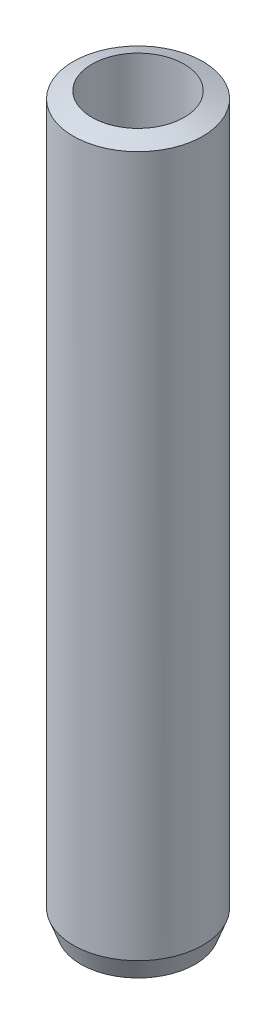
from build123d import *

# Parameters (mm, degrees)
SKETCH1_R           = 50
BOSS_EXTRUDE1_DEPTH = 562.517728
SKETCH2_R           = 35.621530439
CUT_EXTRUDE1_DEPTH  = 567.944613092
CHAMFER1_SIZE       = 5.901113
CHAMFER1_SIZE_2     = 15.741357


with BuildPart() as part:
    # Sketch1 → Boss-Extrude1 (new body)
    with BuildSketch(Plane(origin=(0, 0, 0), x_dir=(1, 0, 0), z_dir=(0, 1, 0))):
        with Locations(Location((0, 0, 0), (0, 0, 270))):
            Circle(SKETCH1_R)
    extrude(amount=BOSS_EXTRUDE1_DEPTH)

    # Sketch2 → Cut-Extrude1 (cut, through all)
    with BuildSketch(Plane(origin=(0, 0, 0), x_dir=(1, 0, 0), z_dir=(0, 1, 0))):
        with Locations(Location((0, 0, 0), (0, 0, 270))):
            Circle(SKETCH2_R)
    extrude(amount=CUT_EXTRUDE1_DEPTH, mode=Mode.SUBTRACT)

    # Chamfer1
    # the kernel refuses this chamfer: 15.741357, 5.901113 mm, written as the material it takes off along each edge
    with BuildSketch(Plane(origin=(0, 562.517728, 0), x_dir=(0, 0, 1), z_dir=(-1, 0, 0))) as chamfer1_piece_1:
        Polygon((50, -CHAMFER1_SIZE), (50 - CHAMFER1_SIZE_2, 0), (50, 0), align=None)
    revolve(axis=Axis((0, 562.517728, 0), (0, 1, 0)), mode=Mode.SUBTRACT)
    with BuildSketch(Plane(origin=(0, 0, 0), x_dir=(0, 0, 1), z_dir=(-1, 0, 0))) as chamfer1_piece_2:
        Polygon((50, CHAMFER1_SIZE_2), (50 - CHAMFER1_SIZE, 0), (50, 0), align=None)
    revolve(axis=Axis((0, 0, 0), (0, 1, 0)), mode=Mode.SUBTRACT)


solid = part.part
